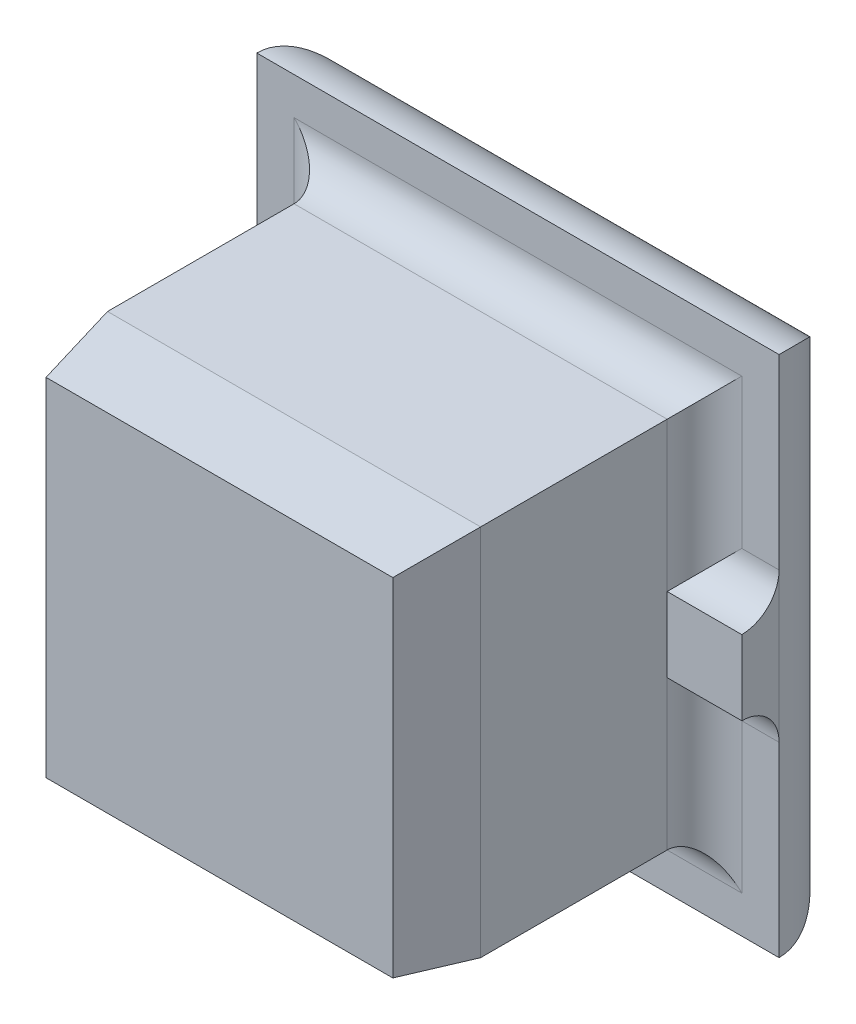
from build123d import *
from OCP.BRepFilletAPI import BRepFilletAPI_MakeChamfer

# Parameters (mm, degrees)
SKETCH1_W           = 10
SKETCH1_H           = 10
BOSS_EXTRUDE1_DEPTH = 8
SKETCH2_W           = 14
SKETCH2_H           = 14
BOSS_EXTRUDE2_DEPTH = 2
FILLET1_R           = 2
CHAMFER1_SIZE       = 2
CHAMFER1_SIZE2      = 0.352653961
SKETCH3_W           = 2
SKETCH3_H           = 2
BOSS_EXTRUDE3_DEPTH = 1
FILLET2_R           = 1


with BuildPart() as part:
    # Sketch1 → Boss-Extrude1 (new body)
    with BuildSketch(Plane.XY):
        Rectangle(SKETCH1_W, SKETCH1_H)
    extrude(amount=BOSS_EXTRUDE1_DEPTH)

    # Sketch2 → Boss-Extrude2 (add)
    with BuildSketch(Plane(origin=(0, 0, 0), x_dir=(-1, 0, 0), z_dir=(0, 0, -1))):
        Rectangle(SKETCH2_W, SKETCH2_H)
    extrude(amount=BOSS_EXTRUDE2_DEPTH)

    # Fillet1
    fillet1_edges = [part.edges().sort_by_distance(p)[0] for p in [
        (0, 7, -2),
        (-7, 0, -2),
        (0, -7, -2),
        (7, 0, -2),
    ]]
    fillet(fillet1_edges, radius=FILLET1_R - 0.0001)  # a hair under: the kernel refuses the full size

    # Chamfer1: one chamfer whose edges measure the first distance from different faces: ONE call of the kernel's chamfer builder (chamfer() names one face for all edges)
    chamfer1_edges_1 = [part.edges().sort_by_distance(p)[0] for p in [
        (5, 0, 8),
    ]]
    chamfer1_side_1 = [part.faces().sort_by_distance(p)[0] for p in [
        (5, 0, 4),
    ]]
    chamfer1_edges_2 = [part.edges().sort_by_distance(p)[0] for p in [
        (0, 5, 8),
    ]]
    chamfer1_side_2 = [part.faces().sort_by_distance(p)[0] for p in [
        (0, 5, 4),
    ]]
    chamfer1_edges_3 = [part.edges().sort_by_distance(p)[0] for p in [
        (-5, 0, 8),
    ]]
    chamfer1_side_3 = [part.faces().sort_by_distance(p)[0] for p in [
        (-5, 0, 4),
    ]]
    chamfer1_edges_4 = [part.edges().sort_by_distance(p)[0] for p in [
        (0, -5, 8),
    ]]
    chamfer1_side_4 = [part.faces().sort_by_distance(p)[0] for p in [
        (0, -5, 4),
    ]]
    chamfer1 = BRepFilletAPI_MakeChamfer(part.part.solid().wrapped)
    for e in chamfer1_edges_1:
        chamfer1.Add(CHAMFER1_SIZE, CHAMFER1_SIZE2, e.wrapped, chamfer1_side_1[0].wrapped)  # the first distance lies on this face
    for e in chamfer1_edges_2:
        chamfer1.Add(CHAMFER1_SIZE, CHAMFER1_SIZE2, e.wrapped, chamfer1_side_2[0].wrapped)  # the first distance lies on this face
    for e in chamfer1_edges_3:
        chamfer1.Add(CHAMFER1_SIZE, CHAMFER1_SIZE2, e.wrapped, chamfer1_side_3[0].wrapped)  # the first distance lies on this face
    for e in chamfer1_edges_4:
        chamfer1.Add(CHAMFER1_SIZE, CHAMFER1_SIZE2, e.wrapped, chamfer1_side_4[0].wrapped)  # the first distance lies on this face
    add(Compound.cast(chamfer1.Shape()), mode=Mode.REPLACE)

    # Sketch3 → Boss-Extrude3 (add)
    with BuildSketch(Plane.XY):
        with Locations((-6, 0)):
            Rectangle(SKETCH3_W, SKETCH3_H)
        with Locations((6, 0)):
            Rectangle(SKETCH3_W, SKETCH3_H)
    extrude(amount=BOSS_EXTRUDE3_DEPTH)

    # Fillet2
    fillet2_edges = [part.edges().sort_by_distance(p)[0] for p in [
        (6, 1, 0),
        (6, -1, 0),
        (-6, -1, 0),
        (-6, 1, 0),
        (5, 3, 0),
        (5, -3, 0),
        (-5, 3, 0),
        (-5, -3, 0),
        (0, 5, 0),
        (0, -5, 0),
    ]]
    fillet(fillet2_edges, radius=FILLET2_R - 0.0001)  # a hair under: the kernel refuses the full size


solid = part.part
